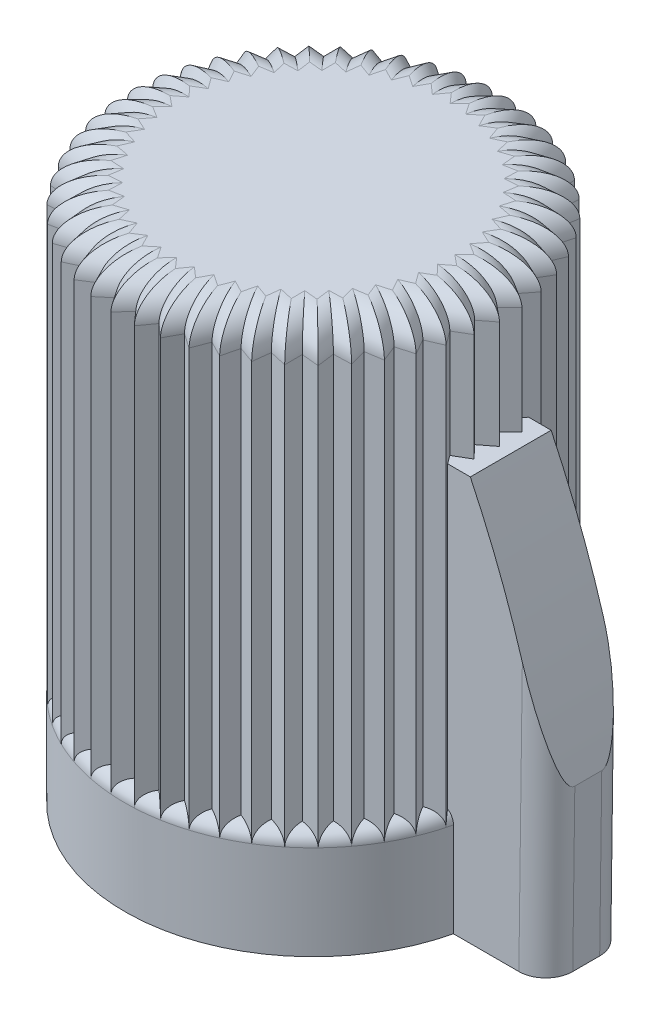
from build123d import *

# Parameters (mm, degrees)
SKETCH1_R           = 7
BOSS_EXTRUDE1_DEPTH = 20
SKETCH2_R           = 3.125
CUT_EXTRUDE1_DEPTH  = 17
SKETCH3_R           = 6
CUT_EXTRUDE2_DEPTH  = 4
SKETCH4_OUTSIDE_W   = 21.628
SKETCH4_OUTSIDE_H   = 21.628
CUT_EXTRUDE4_DEPTH  = 16
FILLET1_R           = 0.5
FILLET2_R           = 1
SKETCH5_W           = 5
SKETCH5_H           = 3
BOSS_EXTRUDE2_DEPTH = 15
CUT_EXTRUDE5_DEPTH  = 25.244872775
CUT_EXTRUDE6_DEPTH  = 25.244872775
FILLET10_R          = 1


with BuildPart() as part:
    # Sketch1 → Boss-Extrude1 (new body)
    with BuildSketch(Plane(origin=(0, 0, 0), x_dir=(1, 0, 0), z_dir=(0, 1, 0))):
        with Locations(Location((0, 0, 0), (0, 0, 270))):
            Circle(SKETCH1_R)
    extrude(amount=BOSS_EXTRUDE1_DEPTH)

    # Sketch2 → Cut-Extrude1 (cut)
    with BuildSketch(Plane.XZ):
        with Locations(Location((0, 0, 0), (0, 0, 270))):
            Circle(SKETCH2_R)
    extrude(amount=-CUT_EXTRUDE1_DEPTH, mode=Mode.SUBTRACT)

    # Sketch3 → Cut-Extrude2 (cut)
    with BuildSketch(Plane.XZ):
        with Locations(Location((0, 0, 0), (0, 0, 270))):
            Circle(SKETCH3_R)
    extrude(amount=-CUT_EXTRUDE2_DEPTH, mode=Mode.SUBTRACT)

    # Sketch4 outside → Cut-Extrude4 (cut)
    with BuildSketch(Plane(origin=(0, 20, 0), x_dir=(1, 0, 0), z_dir=(0, 1, 0))):
        Rectangle(SKETCH4_OUTSIDE_W, SKETCH4_OUTSIDE_H)
        Polygon((6.368056357, -1.303018892), (6.756263467, -1.831093653), (6.154530759, -2.090873294), (6.473491423, -2.66343928), (5.843944535, -2.845753375), (6.088628552, -3.453780878), (5.441195815, -3.555754225), (5.607744372, -4.189654289), (4.952636186, -4.209678706), (5.038422713, -4.859454348), (4.385970526, -4.79721404), (4.389642118, -5.45261791), (3.75013549, -5.309094443), (3.671634245, -5.95979043), (3.055158578, -5.737247255), (2.895722506, -6.372973495), (2.31199999, -6.07492025), (2.074143494, -6.685650961), (1.532379781, -6.316788124), (1.219854, -6.892891717), (0.728593027, -6.459036476), (0.346326679, -6.991427453), (-0.086684074, -6.499421964), (-0.53266242, -6.979704202), (-0.900594115, -6.437307686), (-1.403251115, -6.857906846), (-1.700301249, -6.273673219), (-2.251709701, -6.627956202), (-2.473193617, -6.011099178), (-3.06465748, -6.29347873), (-3.207082244, -5.653726513), (-3.82927378, -5.859749339), (-3.890393268, -5.207191203), (-4.533500145, -5.3336082), (-4.512350466, -4.678535377), (-5.166230505, -4.723352874), (-5.063145202, -4.076096253), (-5.717486323, -4.038607451), (-5.534091114, -3.409374656), (-6.178573967, -3.290170776), (-5.917761102, -2.688885185), (-6.542221808, -2.489846143), (-6.208104463, -1.925990387), (-6.802694903, -1.650255148), (-6.400542308, -1.132721571), (-6.955885436, -0.784638645), (-6.492039778, -0.321589059), (-6.9993775, 0.093352079), (-6.481153902, 0.494615104), (-6.9324852, 0.969870585), (-6.368056357, 1.303018892), (-6.756263467, 1.831093653), (-6.154530759, 2.090873294), (-6.473491423, 2.66343928), (-5.843944535, 2.845753375), (-6.088628552, 3.453780878), (-5.441195815, 3.555754225), (-5.607744372, 4.189654289), (-4.952636186, 4.209678706), (-5.038422713, 4.859454348), (-4.385970526, 4.79721404), (-4.389642118, 5.45261791), (-3.75013549, 5.309094443), (-3.671634245, 5.95979043), (-3.055158578, 5.737247255), (-2.895722506, 6.372973495), (-2.31199999, 6.07492025), (-2.074143494, 6.685650961), (-1.532379781, 6.316788124), (-1.219854, 6.892891717), (-0.728593027, 6.459036476), (-0.346326679, 6.991427453), (0.086684074, 6.499421964), (0.53266242, 6.979704202), (0.900594115, 6.437307686), (1.403251115, 6.857906846), (1.700301249, 6.273673219), (2.251709701, 6.627956202), (2.473193617, 6.011099178), (3.06465748, 6.29347873), (3.207082244, 5.653726513), (3.82927378, 5.859749339), (3.890393268, 5.207191203), (4.533500145, 5.3336082), (4.512350466, 4.678535377), (5.166230505, 4.723352874), (5.063145202, 4.076096253), (5.717486323, 4.038607451), (5.534091114, 3.409374656), (6.178573967, 3.290170776), (5.917761102, 2.688885185), (6.542221808, 2.489846143), (6.208104463, 1.925990387), (6.802694903, 1.650255148), (6.400542308, 1.132721571), (6.955885436, 0.784638645), (6.492039778, 0.321589059), (6.9993775, -0.093352079), (6.481153902, -0.494615104), (6.9324852, -0.969870585), align=None, mode=Mode.SUBTRACT)
    extrude(amount=-CUT_EXTRUDE4_DEPTH, mode=Mode.SUBTRACT)

    # Fillet1
    # the kernel refuses this fillet: 0.5 mm, written as the material it takes off along each edge
    with BuildSketch(Plane(origin=(0, 4, 0), x_dir=(0.9999110714464502, 0, 0.013336011353174413), z_dir=(0.013336011353174413, 0, -0.9999110714464502))) as fillet1_piece_1_section:
        with BuildLine():
            CenterArc((7 - FILLET1_R, FILLET1_R), FILLET1_R, 270, 90)
            Line((7 - FILLET1_R, 0), (7, 0))
            Line((7, 0), (7, FILLET1_R))
        make_face()
    fillet1_piece_1 = revolve(axis=Axis((0, 4, 0), (0, -1, 0)), revolution_arc=7.2, mode=Mode.PRIVATE)
    fillet1_piece_1 = split(fillet1_piece_1, bisect_by=Plane(origin=(6.692100794, 3.869530102, 0.716743876), z_dir=(0.7251223952651457, 0, -0.6886200054347376)), keep=Keep.TOP, mode=Mode.PRIVATE)
    fillet1_piece_1 = split(fillet1_piece_1, bisect_by=Plane(origin=(6.723365439, 3.869530102, 0.307069546), z_dir=(0.6122281957924257, 0, 0.7906811217404595)), keep=Keep.TOP, mode=Mode.PRIVATE)
    add(fillet1_piece_1, mode=Mode.SUBTRACT)
    with BuildSketch(Plane(origin=(0, 4, 0), x_dir=(0.9903550285633907, 0, 0.13855294078151292), z_dir=(0.13855294078151292, 0, -0.9903550285633907))) as fillet1_piece_2_section:
        with BuildLine():
            CenterArc((7 - FILLET1_R, FILLET1_R), FILLET1_R, 270, 90)
            Line((7 - FILLET1_R, 0), (7, 0))
            Line((7, 0), (7, FILLET1_R))
        make_face()
    fillet1_piece_2 = revolve(axis=Axis((0, 4, 0), (0, -1, 0)), revolution_arc=7.2, mode=Mode.PRIVATE)
    fillet1_piece_2 = split(fillet1_piece_2, bisect_by=Plane(origin=(6.631863682, 3.86953012, 1.147309338), z_dir=(0.508301971898917, 0, 0.8611789043884395)), keep=Keep.TOP, mode=Mode.PRIVATE)
    fillet1_piece_2 = split(fillet1_piece_2, bisect_by=Plane(origin=(6.549499752, 3.86953012, 1.549834767), z_dir=(0.8057115605731215, 0, -0.5923080964825866)), keep=Keep.TOP, mode=Mode.PRIVATE)
    add(fillet1_piece_2, mode=Mode.SUBTRACT)
    with BuildSketch(Plane(origin=(0, 4, 0), x_dir=(0.9651804952704691, 0, 0.2615848075662121), z_dir=(0.2615848075662121, 0, -0.9651804952704691))) as fillet1_piece_3_section:
        with BuildLine():
            CenterArc((7 - FILLET1_R, FILLET1_R), FILLET1_R, 270, 90)
            Line((7 - FILLET1_R, 0), (7, 0))
            Line((7, 0), (7, FILLET1_R))
        make_face()
    fillet1_piece_3 = revolve(axis=Axis((0, 4, 0), (0, -1, 0)), revolution_arc=7.2, mode=Mode.PRIVATE)
    fillet1_piece_3 = split(fillet1_piece_3, bisect_by=Plane(origin=(6.303609189, 3.869530083, 2.358483842), z_dir=(0.8735941732621048, 0, -0.4866551350211972)), keep=Keep.TOP, mode=Mode.PRIVATE)
    fillet1_piece_3 = split(fillet1_piece_3, bisect_by=Plane(origin=(6.435773453, 3.869530083, 1.969455387), z_dir=(0.3963595222636914, 0, 0.9180953812708669)), keep=Keep.TOP, mode=Mode.PRIVATE)
    add(fillet1_piece_3, mode=Mode.SUBTRACT)
    with BuildSketch(Plane(origin=(0, 4, 0), x_dir=(0.9247844889962518, 0, 0.3804913256724016), z_dir=(0.3804913256724016, 0, -0.9247844889962518))) as fillet1_piece_4_section:
        with BuildLine():
            CenterArc((7 - FILLET1_R, FILLET1_R), FILLET1_R, 270, 90)
            Line((7 - FILLET1_R, 0), (7, 0))
            Line((7, 0), (7, FILLET1_R))
        make_face()
    fillet1_piece_4 = revolve(axis=Axis((0, 4, 0), (0, -1, 0)), revolution_arc=7.2, mode=Mode.PRIVATE)
    fillet1_piece_4 = split(fillet1_piece_4, bisect_by=Plane(origin=(5.958306941, 3.869530109, 3.129938213), z_dir=(0.9276996839788816, 0, -0.3733273313668364)), keep=Keep.TOP, mode=Mode.PRIVATE)
    fillet1_piece_4 = split(fillet1_piece_4, bisect_by=Plane(origin=(6.138187255, 3.869530109, 2.760541937), z_dir=(0.27816624618866026, 0, 0.9605329455470591)), keep=Keep.TOP, mode=Mode.PRIVATE)
    add(fillet1_piece_4, mode=Mode.SUBTRACT)
    with BuildSketch(Plane(origin=(0, 4, 0), x_dir=(0.8698040788910874, 0, 0.49339726827823754), z_dir=(0.49339726827823754, 0, -0.8698040788910874))) as fillet1_piece_5_section:
        with BuildLine():
            CenterArc((7 - FILLET1_R, FILLET1_R), FILLET1_R, 270, 90)
            Line((7 - FILLET1_R, 0), (7, 0))
            Line((7, 0), (7, FILLET1_R))
        make_face()
    fillet1_piece_5 = revolve(axis=Axis((0, 4, 0), (0, -1, 0)), revolution_arc=7.2, mode=Mode.PRIVATE)
    fillet1_piece_5 = split(fillet1_piece_5, bisect_by=Plane(origin=(5.519038633, 3.86953012, 3.85203159), z_dir=(0.9671748164983809, 0, -0.2541119326818861)), keep=Keep.TOP, mode=Mode.PRIVATE)
    fillet1_piece_5 = split(fillet1_piece_5, bisect_by=Plane(origin=(5.743798172, 3.86953012, 3.508093096), z_dir=(0.1555861222427738, 0, 0.9878223314774053)), keep=Keep.TOP, mode=Mode.PRIVATE)
    add(fillet1_piece_5, mode=Mode.SUBTRACT)
    with BuildSketch(Plane(origin=(0, 4, 0), x_dir=(0.8011063388660395, 0, 0.5985220412220841), z_dir=(0.5985220412220841, 0, -0.8011063388660395))) as fillet1_piece_6_section:
        with BuildLine():
            CenterArc((7 - FILLET1_R, FILLET1_R), FILLET1_R, 270, 90)
            Line((7 - FILLET1_R, 0), (7, 0))
            Line((7, 0), (7, FILLET1_R))
        make_face()
    fillet1_piece_6 = revolve(axis=Axis((0, 4, 0), (0, -1, 0)), revolution_arc=7.2, mode=Mode.PRIVATE)
    fillet1_piece_6 = split(fillet1_piece_6, bisect_by=Plane(origin=(4.992731791, 3.869530084, 4.513376131), z_dir=(0.9913970243994719, 0, -0.13088903701942792)), keep=Keep.TOP, mode=Mode.PRIVATE)
    fillet1_piece_6 = split(fillet1_piece_6, bisect_by=Plane(origin=(5.258825942, 3.869530084, 4.200319532), z_dir=(0.030552312206472972, 0, 0.999533169143895)), keep=Keep.TOP, mode=Mode.PRIVATE)
    add(fillet1_piece_6, mode=Mode.SUBTRACT)
    with BuildSketch(Plane(origin=(0, 4, 0), x_dir=(0.7197746733193445, 0, 0.694207764036121), z_dir=(0.694207764036121, 0, -0.7197746733193445))) as fillet1_piece_7_section:
        with BuildLine():
            CenterArc((7 - FILLET1_R, FILLET1_R), FILLET1_R, 270, 90)
            Line((7 - FILLET1_R, 0), (7, 0))
            Line((7, 0), (7, FILLET1_R))
        make_face()
    fillet1_piece_7 = revolve(axis=Axis((0, 4, 0), (0, -1, 0)), revolution_arc=7.2, mode=Mode.PRIVATE)
    fillet1_piece_7 = split(fillet1_piece_7, bisect_by=Plane(origin=(4.387686585, 3.869530084, 5.103542032), z_dir=(0.9999843089939069, 0, -0.005601943053854549)), keep=Keep.TOP, mode=Mode.PRIVATE)
    fillet1_piece_7 = split(fillet1_piece_7, bisect_by=Plane(origin=(4.6909189, 3.869530084, 4.826304418), z_dir=(-0.09496332604438978, 0, 0.9954807716408123)), keep=Keep.TOP, mode=Mode.PRIVATE)
    add(fillet1_piece_7, mode=Mode.SUBTRACT)
    with BuildSketch(Plane(origin=(0, 4, 0), x_dir=(0.6270917312018547, 0, 0.7789454157116921), z_dir=(0.7789454157116921, 0, -0.6270917312018547))) as fillet1_piece_8_section:
        with BuildLine():
            CenterArc((7 - FILLET1_R, FILLET1_R), FILLET1_R, 270, 90)
            Line((7 - FILLET1_R, 0), (7, 0))
            Line((7, 0), (7, FILLET1_R))
        make_face()
    fillet1_piece_8 = revolve(axis=Axis((0, 4, 0), (0, -1, 0)), revolution_arc=7.2, mode=Mode.PRIVATE)
    fillet1_piece_8 = split(fillet1_piece_8, bisect_by=Plane(origin=(3.71344494, 3.869530103, 5.613222025), z_dir=(0.992801243673837, 0, 0.11977349690011761)), keep=Keep.TOP, mode=Mode.PRIVATE)
    fillet1_piece_8 = split(fillet1_piece_8, bisect_by=Plane(origin=(4.049033272, 3.869530103, 5.376175602), z_dir=(-0.2189813359151886, 0, 0.9757290476975662)), keep=Keep.TOP, mode=Mode.PRIVATE)
    add(fillet1_piece_8, mode=Mode.SUBTRACT)
    with BuildSketch(Plane(origin=(0, 4, 0), x_dir=(0.5245191778768692, 0, 0.8513986328620532), z_dir=(0.8513986328620532, 0, -0.5245191778768692))) as fillet1_piece_9_section:
        with BuildLine():
            CenterArc((7 - FILLET1_R, FILLET1_R), FILLET1_R, 270, 90)
            Line((7 - FILLET1_R, 0), (7, 0))
            Line((7, 0), (7, FILLET1_R))
        make_face()
    fillet1_piece_9 = revolve(axis=Axis((0, 4, 0), (0, -1, 0)), revolution_arc=7.2, mode=Mode.PRIVATE)
    fillet1_piece_9 = split(fillet1_piece_9, bisect_by=Plane(origin=(2.980640051, 3.86953012, 6.034378153), z_dir=(0.9699611096703153, 0, 0.24326003725875428)), keep=Keep.TOP, mode=Mode.PRIVATE)
    fillet1_piece_9 = split(fillet1_piece_9, bisect_by=Plane(origin=(3.343291969, 3.86953012, 5.841261287), z_dir=(-0.3395458793054989, 0, 0.9405894937998487)), keep=Keep.TOP, mode=Mode.PRIVATE)
    add(fillet1_piece_9, mode=Mode.SUBTRACT)
    with BuildSketch(Plane(origin=(0, 4, 0), x_dir=(0.41367464378419627, 0, 0.9104247849712893), z_dir=(0.9104247849712893, 0, -0.41367464378419627))) as fillet1_piece_10_section:
        with BuildLine():
            CenterArc((7 - FILLET1_R, FILLET1_R), FILLET1_R, 270, 90)
            Line((7 - FILLET1_R, 0), (7, 0))
            Line((7, 0), (7, FILLET1_R))
        make_face()
    fillet1_piece_10 = revolve(axis=Axis((0, 4, 0), (0, -1, 0)), revolution_arc=7.2, mode=Mode.PRIVATE)
    fillet1_piece_10 = split(fillet1_piece_10, bisect_by=Plane(origin=(2.200828687, 3.86953012, 6.360368535), z_dir=(0.9318241095406106, 0, 0.36291022151332175)), keep=Keep.TOP, mode=Mode.PRIVATE)
    fillet1_piece_10 = split(fillet1_piece_10, bisect_by=Plane(origin=(2.584824948, 3.86953012, 6.21422679), z_dir=(-0.45475558134428334, 0, 0.8906162817039799)), keep=Keep.TOP, mode=Mode.PRIVATE)
    add(fillet1_piece_10, mode=Mode.SUBTRACT)
    with BuildSketch(Plane(origin=(0, 4, 0), x_dir=(0.29630621344179275, 0, 0.9550929943601235), z_dir=(0.9550929943601235, 0, -0.29630621344179275))) as fillet1_piece_11_section:
        with BuildLine():
            CenterArc((7 - FILLET1_R, FILLET1_R), FILLET1_R, 270, 90)
            Line((7 - FILLET1_R, 0), (7, 0))
            Line((7, 0), (7, FILLET1_R))
        make_face()
    fillet1_piece_11 = revolve(axis=Axis((0, 4, 0), (0, -1, 0)), revolution_arc=7.2, mode=Mode.PRIVATE)
    fillet1_piece_11 = split(fillet1_piece_11, bisect_by=Plane(origin=(1.386308941, 3.86953012, 6.586052105), z_dir=(0.8789916865587111, 0, 0.4768370947825607)), keep=Keep.TOP, mode=Mode.PRIVATE)
    fillet1_piece_11 = split(fillet1_piece_11, bisect_by=Plane(origin=(1.785593694, 3.86953012, 6.489190225), z_dir=(-0.5627935162074544, 0, 0.8265975188172595)), keep=Keep.TOP, mode=Mode.PRIVATE)
    add(fillet1_piece_11, mode=Mode.SUBTRACT)
    with BuildSketch(Plane(origin=(0, 4, 0), x_dir=(0.17426485710865985, 0, 0.984698816682999), z_dir=(0.984698816682999, 0, -0.17426485710865985))) as fillet1_piece_12_section:
        with BuildLine():
            CenterArc((7 - FILLET1_R, FILLET1_R), FILLET1_R, 270, 90)
            Line((7 - FILLET1_R, 0), (7, 0))
            Line((7, 0), (7, FILLET1_R))
        make_face()
    fillet1_piece_12 = revolve(axis=Axis((0, 4, 0), (0, -1, 0)), revolution_arc=7.2, mode=Mode.PRIVATE)
    fillet1_piece_12 = split(fillet1_piece_12, bisect_by=Plane(origin=(0.549926273, 3.869530099, 6.7078697), z_dir=(0.8122970395955981, 0, 0.583243962218408)), keep=Keep.TOP, mode=Mode.PRIVATE)
    fillet1_piece_12 = split(fillet1_piece_12, bisect_by=Plane(origin=(0.958202554, 3.869530099, 6.661815248), z_dir=(-0.6619558611234801, 0, 0.7495428192733701)), keep=Keep.TOP, mode=Mode.PRIVATE)
    add(fillet1_piece_12, mode=Mode.SUBTRACT)
    with BuildSketch(Plane(origin=(0, 4, 0), x_dir=(0, 0, 1), z_dir=(1, 0, 0))) as fillet1_piece_13_section:
        with BuildLine():
            CenterArc((7 - FILLET1_R, FILLET1_R), FILLET1_R, 270, 90)
            Line((7 - FILLET1_R, 0), (7, 0))
            Line((7, 0), (7, FILLET1_R))
        make_face()
    fillet1_piece_13 = revolve(axis=Axis((0, 4, 0), (0, -1, 0)), revolution_arc=4.364119817, mode=Mode.PRIVATE)
    fillet1_piece_13 = split(fillet1_piece_13, bisect_by=Plane(origin=(-0.354413495, 3.872749613, 6.787744674), z_dir=(0.732791983075327, 0, 0.680452723957021)), keep=Keep.TOP, mode=Mode.PRIVATE)
    fillet1_piece_13 = split(fillet1_piece_13, bisect_by=Plane(origin=(0.053658359, 3.872749613, 6.658885087), z_dir=(-0.7506787666763268, 0, 0.6606673817143609)), keep=Keep.TOP, mode=Mode.PRIVATE)
    add(fillet1_piece_13, mode=Mode.SUBTRACT)
    with BuildSketch(Plane(origin=(0, 4, 0), x_dir=(-0.07609463144032609, 0, 0.9971006002735938), z_dir=(0.9971006002735938, 0, 0.07609463144032609))) as fillet1_piece_14_section:
        with BuildLine():
            CenterArc((7 - FILLET1_R, FILLET1_R), FILLET1_R, 270, 90)
            Line((7 - FILLET1_R, 0), (7, 0))
            Line((7, 0), (7, FILLET1_R))
        make_face()
    fillet1_piece_14 = revolve(axis=Axis((0, 4, 0), (0, -1, 0)), revolution_arc=7.2, mode=Mode.PRIVATE)
    fillet1_piece_14 = split(fillet1_piece_14, bisect_by=Plane(origin=(-1.13553003, 3.86953012, 6.633890741), z_dir=(0.6417303592332552, 0, 0.7669303397560676)), keep=Keep.TOP, mode=Mode.PRIVATE)
    fillet1_piece_14 = split(fillet1_piece_14, bisect_by=Plane(origin=(-0.728627219, 3.86953012, 6.690817363), z_dir=(-0.8275630196449273, 0, 0.5613728248821542)), keep=Keep.TOP, mode=Mode.PRIVATE)
    add(fillet1_piece_14, mode=Mode.SUBTRACT)
    with BuildSketch(Plane(origin=(0, 4, 0), x_dir=(-0.2004644449642526, 0, 0.9797009780056228), z_dir=(0.9797009780056228, 0, 0.2004644449642526))) as fillet1_piece_15_section:
        with BuildLine():
            CenterArc((7 - FILLET1_R, FILLET1_R), FILLET1_R, 270, 90)
            Line((7 - FILLET1_R, 0), (7, 0))
            Line((7, 0), (7, FILLET1_R))
        make_face()
    fillet1_piece_15 = revolve(axis=Axis((0, 4, 0), (0, -1, 0)), revolution_arc=7.2, mode=Mode.PRIVATE)
    fillet1_piece_15 = split(fillet1_piece_15, bisect_by=Plane(origin=(-1.958023014, 3.86953012, 6.43926088), z_dir=(0.5405482642749323, 0, 0.8413130059551903)), keep=Keep.TOP, mode=Mode.PRIVATE)
    fillet1_piece_15 = split(fillet1_piece_15, bisect_by=Plane(origin=(-1.561463551, 3.86953012, 6.546737065), z_dir=(-0.8913961094315425, 0, 0.453225083253685)), keep=Keep.TOP, mode=Mode.PRIVATE)
    add(fillet1_piece_15, mode=Mode.SUBTRACT)
    with BuildSketch(Plane(origin=(0, 4, 0), x_dir=(-0.32167281443943807, 0, 0.9468508860695071), z_dir=(0.9468508860695071, 0, 0.32167281443943807))) as fillet1_piece_16_section:
        with BuildLine():
            CenterArc((7 - FILLET1_R, FILLET1_R), FILLET1_R, 270, 90)
            Line((7 - FILLET1_R, 0), (7, 0))
            Line((7, 0), (7, FILLET1_R))
        make_face()
    fillet1_piece_16 = revolve(axis=Axis((0, 4, 0), (0, -1, 0)), revolution_arc=7.2, mode=Mode.PRIVATE)
    fillet1_piece_16 = split(fillet1_piece_16, bisect_by=Plane(origin=(-2.749636806, 3.86953012, 6.143080029), z_dir=(0.4308414002811142, 0, 0.9024276634743689)), keep=Keep.TOP, mode=Mode.PRIVATE)
    fillet1_piece_16 = split(fillet1_piece_16, bisect_by=Plane(origin=(-2.36967467, 3.86953012, 6.299410812), z_dir=(-0.9411713500781984, 0, 0.3379297113187614)), keep=Keep.TOP, mode=Mode.PRIVATE)
    add(fillet1_piece_16, mode=Mode.SUBTRACT)
    with BuildSketch(Plane(origin=(0, 4, 0), x_dir=(-0.4378082114728888, 0, 0.8990683900387725), z_dir=(0.8990683900387725, 0, 0.4378082114728888))) as fillet1_piece_17_section:
        with BuildLine():
            CenterArc((7 - FILLET1_R, FILLET1_R), FILLET1_R, 270, 90)
            Line((7 - FILLET1_R, 0), (7, 0))
            Line((7, 0), (7, FILLET1_R))
        make_face()
    fillet1_piece_17 = revolve(axis=Axis((0, 4, 0), (0, -1, 0)), revolution_arc=7.2, mode=Mode.PRIVATE)
    fillet1_piece_17 = split(fillet1_piece_17, bisect_by=Plane(origin=(-3.497887182, 3.86953012, 5.750019136), z_dir=(0.3143399100326887, 0, 0.9493104976563996)), keep=Keep.TOP, mode=Mode.PRIVATE)
    fillet1_piece_17 = split(fillet1_piece_17, bisect_by=Plane(origin=(-3.140514604, 3.86953012, 5.952739087), z_dir=(-0.9761037563056076, 0, 0.2173049859669195)), keep=Keep.TOP, mode=Mode.PRIVATE)
    add(fillet1_piece_17, mode=Mode.SUBTRACT)
    with BuildSketch(Plane(origin=(0, 4, 0), x_dir=(-0.547039111477463, 0, 0.8371070484197034), z_dir=(0.8371070484197034, 0, 0.547039111477463))) as fillet1_piece_18_section:
        with BuildLine():
            CenterArc((7 - FILLET1_R, FILLET1_R), FILLET1_R, 270, 90)
            Line((7 - FILLET1_R, 0), (7, 0))
            Line((7, 0), (7, FILLET1_R))
        make_face()
    fillet1_piece_18 = revolve(axis=Axis((0, 4, 0), (0, -1, 0)), revolution_arc=7.2, mode=Mode.PRIVATE)
    fillet1_piece_18 = split(fillet1_piece_18, bisect_by=Plane(origin=(-4.190973788, 3.86953012, 5.266277007), z_dir=(0.1928810916254839, 0, 0.981222138199787)), keep=Keep.TOP, mode=Mode.PRIVATE)
    fillet1_piece_18 = split(fillet1_piece_18, bisect_by=Plane(origin=(-3.861826747, 3.86953012, 5.512189111), z_dir=(-0.9956424231999574, 0, 0.09325323117467292)), keep=Keep.TOP, mode=Mode.PRIVATE)
    add(fillet1_piece_18, mode=Mode.SUBTRACT)
    with BuildSketch(Plane(origin=(0, 4, 0), x_dir=(-0.6476428779087126, 0, 0.7619440285835439), z_dir=(0.7619440285835439, 0, 0.6476428779087126))) as fillet1_piece_19_section:
        with BuildLine():
            CenterArc((7 - FILLET1_R, FILLET1_R), FILLET1_R, 270, 90)
            Line((7 - FILLET1_R, 0), (7, 0))
            Line((7, 0), (7, FILLET1_R))
        make_face()
    fillet1_piece_19 = revolve(axis=Axis((0, 4, 0), (0, -1, 0)), revolution_arc=7.2, mode=Mode.PRIVATE)
    fillet1_piece_19 = split(fillet1_piece_19, bisect_by=Plane(origin=(-4.817966234, 3.86953012, 4.699482543), z_dir=(0.06838042318176764, 0, 0.9976593194700696)), keep=Keep.TOP, mode=Mode.PRIVATE)
    fillet1_piece_19 = split(fillet1_piece_19, bisect_by=Plane(origin=(-4.522235575, 3.86953012, 4.98470862), z_dir=(-0.9994792143124901, 0, -0.03226918277997783)), keep=Keep.TOP, mode=Mode.PRIVATE)
    add(fillet1_piece_19, mode=Mode.SUBTRACT)
    with BuildSketch(Plane(origin=(0, 4, 0), x_dir=(-0.7380329292722395, 0, 0.6747646962533217), z_dir=(0.6747646962533217, 0, 0.7380329292722395))) as fillet1_piece_20_section:
        with BuildLine():
            CenterArc((7 - FILLET1_R, FILLET1_R), FILLET1_R, 270, 90)
            Line((7 - FILLET1_R, 0), (7, 0))
            Line((7, 0), (7, FILLET1_R))
        make_face()
    fillet1_piece_20 = revolve(axis=Axis((0, 4, 0), (0, -1, 0)), revolution_arc=7.2, mode=Mode.PRIVATE)
    fillet1_piece_20 = split(fillet1_piece_20, bisect_by=Plane(origin=(-5.368976475, 3.86953012, 4.058574432), z_dir=(-0.05719864538400738, 0, 0.9983628172995199)), keep=Keep.TOP, mode=Mode.PRIVATE)
    fillet1_piece_20 = split(fillet1_piece_20, bisect_by=Plane(origin=(-5.111326046, 3.86953012, 4.378616296), z_dir=(-0.9875536211553725, 0, -0.15728269244551726)), keep=Keep.TOP, mode=Mode.PRIVATE)
    add(fillet1_piece_20, mode=Mode.SUBTRACT)
    with BuildSketch(Plane(origin=(0, 4, 0), x_dir=(-0.8167837604616414, 0, 0.5769439215782936), z_dir=(0.5769439215782936, 0, 0.8167837604616414))) as fillet1_piece_21_section:
        with BuildLine():
            CenterArc((7 - FILLET1_R, FILLET1_R), FILLET1_R, 270, 90)
            Line((7 - FILLET1_R, 0), (7, 0))
            Line((7, 0), (7, FILLET1_R))
        make_face()
    fillet1_piece_21 = revolve(axis=Axis((0, 4, 0), (0, -1, 0)), revolution_arc=7.2, mode=Mode.PRIVATE)
    fillet1_piece_21 = split(fillet1_piece_21, bisect_by=Plane(origin=(-5.835314749, 3.86953012, 3.353660178), z_dir=(-0.18187565714326803, 0, 0.9833215371071177)), keep=Keep.TOP, mode=Mode.PRIVATE)
    fillet1_piece_21 = split(fillet1_piece_21, bisect_by=Plane(origin=(-5.619807852, 3.86953012, 3.703470577), z_dir=(-0.9600537174566968, 0, -0.27981576009506187)), keep=Keep.TOP, mode=Mode.PRIVATE)
    add(fillet1_piece_21, mode=Mode.SUBTRACT)
    with BuildSketch(Plane(origin=(0, 4, 0), x_dir=(-0.8826534238255954, 0, 0.47002439661038226), z_dir=(0.47002439661038226, 0, 0.8826534238255954))) as fillet1_piece_22_section:
        with BuildLine():
            CenterArc((7 - FILLET1_R, FILLET1_R), FILLET1_R, 270, 90)
            Line((7 - FILLET1_R, 0), (7, 0))
            Line((7, 0), (7, FILLET1_R))
        make_face()
    fillet1_piece_22 = revolve(axis=Axis((0, 4, 0), (0, -1, 0)), revolution_arc=7.2, mode=Mode.PRIVATE)
    fillet1_piece_22 = split(fillet1_piece_22, bisect_by=Plane(origin=(-6.209626625, 3.869530103, 2.595856699), z_dir=(-0.30368438114212065, 0, 0.9527726888667241)), keep=Keep.TOP, mode=Mode.PRIVATE)
    fillet1_piece_22 = split(fillet1_piece_22, bisect_by=Plane(origin=(-6.039661929, 3.869530103, 2.969918909), z_dir=(-0.9174131931254367, 0, -0.39793596605407533)), keep=Keep.TOP, mode=Mode.PRIVATE)
    add(fillet1_piece_22, mode=Mode.SUBTRACT)
    with BuildSketch(Plane(origin=(0, 4, 0), x_dir=(-0.9346031154242217, 0, 0.3556923061289616), z_dir=(0.3556923061289616, 0, 0.9346031154242217))) as fillet1_piece_23_section:
        with BuildLine():
            CenterArc((7 - FILLET1_R, FILLET1_R), FILLET1_R, 270, 90)
            Line((7 - FILLET1_R, 0), (7, 0))
            Line((7, 0), (7, FILLET1_R))
        make_face()
    fillet1_piece_23 = revolve(axis=Axis((0, 4, 0), (0, -1, 0)), revolution_arc=7.2, mode=Mode.PRIVATE)
    fillet1_piece_23 = split(fillet1_piece_23, bisect_by=Plane(origin=(-6.486008977, 3.869530111, 1.79711501), z_dir=(-0.42070382103811527, 0, 0.907198046164083)), keep=Keep.TOP, mode=Mode.PRIVATE)
    fillet1_piece_23 = split(fillet1_piece_23, bisect_by=Plane(origin=(-6.364266933, 3.869530111, 2.189529855), z_dir=(-0.8603045147025131, 0, -0.5097804841129894)), keep=Keep.TOP, mode=Mode.PRIVATE)
    add(fillet1_piece_23, mode=Mode.SUBTRACT)
    with BuildSketch(Plane(origin=(0, 4, 0), x_dir=(-0.9718135575877694, 0, 0.23575073549960174), z_dir=(0.23575073549960174, 0, 0.9718135575877694))) as fillet1_piece_24_section:
        with BuildLine():
            CenterArc((7 - FILLET1_R, FILLET1_R), FILLET1_R, 270, 90)
            Line((7 - FILLET1_R, 0), (7, 0))
            Line((7, 0), (7, FILLET1_R))
        make_face()
    fillet1_piece_24 = revolve(axis=Axis((0, 4, 0), (0, -1, 0)), revolution_arc=7.2, mode=Mode.PRIVATE)
    fillet1_piece_24 = split(fillet1_piece_24, bisect_by=Plane(origin=(-6.660103094, 3.86953012, 0.970031743), z_dir=(-0.5310885103600534, 0, 0.8473163483395912)), keep=Keep.TOP, mode=Mode.PRIVATE)
    fillet1_piece_24 = split(fillet1_piece_24, bisect_by=Plane(origin=(-6.588503646, 3.86953012, 1.374610607), z_dir=(-0.7896283201617239, 0, -0.6135854594093427)), keep=Keep.TOP, mode=Mode.PRIVATE)
    add(fillet1_piece_24, mode=Mode.SUBTRACT)
    with BuildSketch(Plane(origin=(0, 4, 0), x_dir=(-0.993697919414878, 0, 0.11209123494075034), z_dir=(0.11209123494075034, 0, 0.993697919414878))) as fillet1_piece_25_section:
        with BuildLine():
            CenterArc((7 - FILLET1_R, FILLET1_R), FILLET1_R, 270, 90)
            Line((7 - FILLET1_R, 0), (7, 0))
            Line((7, 0), (7, FILLET1_R))
        make_face()
    fillet1_piece_25 = revolve(axis=Axis((0, 4, 0), (0, -1, 0)), revolution_arc=7.2, mode=Mode.PRIVATE)
    fillet1_piece_25 = split(fillet1_piece_25, bisect_by=Plane(origin=(-6.729163407, 3.86953012, 0.127650497), z_dir=(-0.6330976166167106, 0, 0.774071965539536)), keep=Keep.TOP, mode=Mode.PRIVATE)
    fillet1_piece_25 = split(fillet1_piece_25, bisect_by=Plane(origin=(-6.708835719, 3.86953012, 0.538012926), z_dir=(-0.706499215310887, 0, -0.7077138254726277)), keep=Keep.TOP, mode=Mode.PRIVATE)
    add(fillet1_piece_25, mode=Mode.SUBTRACT)
    with BuildSketch(Plane(origin=(0, 4, 0), x_dir=(-0.9999110714464502, 0, -0.013336011353174314), z_dir=(-0.013336011353174314, 0, 0.9999110714464502))) as fillet1_piece_26_section:
        with BuildLine():
            CenterArc((7 - FILLET1_R, FILLET1_R), FILLET1_R, 270, 90)
            Line((7 - FILLET1_R, 0), (7, 0))
            Line((7, 0), (7, FILLET1_R))
        make_face()
    fillet1_piece_26 = revolve(axis=Axis((0, 4, 0), (0, -1, 0)), revolution_arc=7.2, mode=Mode.PRIVATE)
    fillet1_piece_26 = split(fillet1_piece_26, bisect_by=Plane(origin=(-6.692100793, 3.86953012, -0.716743875), z_dir=(-0.7251223952651459, 0, 0.6886200054347373)), keep=Keep.TOP, mode=Mode.PRIVATE)
    fillet1_piece_26 = split(fillet1_piece_26, bisect_by=Plane(origin=(-6.723365445, 3.86953012, -0.307069541), z_dir=(-0.6122281957924258, 0, -0.7906811217404595)), keep=Keep.TOP, mode=Mode.PRIVATE)
    add(fillet1_piece_26, mode=Mode.SUBTRACT)
    with BuildSketch(Plane(origin=(0, 4, 0), x_dir=(-0.9903550285633907, 0, -0.13855294078151303), z_dir=(-0.13855294078151303, 0, 0.9903550285633907))) as fillet1_piece_27_section:
        with BuildLine():
            CenterArc((7 - FILLET1_R, FILLET1_R), FILLET1_R, 270, 90)
            Line((7 - FILLET1_R, 0), (7, 0))
            Line((7, 0), (7, FILLET1_R))
        make_face()
    fillet1_piece_27 = revolve(axis=Axis((0, 4, 0), (0, -1, 0)), revolution_arc=7.2, mode=Mode.PRIVATE)
    fillet1_piece_27 = split(fillet1_piece_27, bisect_by=Plane(origin=(-6.549499753, 3.869530099, -1.549834768), z_dir=(-0.8057115605731229, 0, 0.592308096482585)), keep=Keep.TOP, mode=Mode.PRIVATE)
    fillet1_piece_27 = split(fillet1_piece_27, bisect_by=Plane(origin=(-6.631863675, 3.869530099, -1.147309342), z_dir=(-0.5083019718989221, 0, -0.8611789043884365)), keep=Keep.TOP, mode=Mode.PRIVATE)
    add(fillet1_piece_27, mode=Mode.SUBTRACT)
    with BuildSketch(Plane(origin=(0, 4, 0), x_dir=(-0.9651804952704691, 0, -0.261584807566212), z_dir=(-0.261584807566212, 0, 0.9651804952704691))) as fillet1_piece_28_section:
        with BuildLine():
            CenterArc((7 - FILLET1_R, FILLET1_R), FILLET1_R, 270, 90)
            Line((7 - FILLET1_R, 0), (7, 0))
            Line((7, 0), (7, FILLET1_R))
        make_face()
    fillet1_piece_28 = revolve(axis=Axis((0, 4, 0), (0, -1, 0)), revolution_arc=7.2, mode=Mode.PRIVATE)
    fillet1_piece_28 = split(fillet1_piece_28, bisect_by=Plane(origin=(-6.303609188, 3.869530095, -2.358483841), z_dir=(-0.8735941732621044, 0, 0.48665513502119784)), keep=Keep.TOP, mode=Mode.PRIVATE)
    fillet1_piece_28 = split(fillet1_piece_28, bisect_by=Plane(origin=(-6.435773458, 3.869530095, -1.969455385), z_dir=(-0.39635952226369026, 0, -0.9180953812708673)), keep=Keep.TOP, mode=Mode.PRIVATE)
    add(fillet1_piece_28, mode=Mode.SUBTRACT)
    with BuildSketch(Plane(origin=(0, 4, 0), x_dir=(-0.9247844889962515, 0, -0.3804913256724019), z_dir=(-0.3804913256724019, 0, 0.9247844889962515))) as fillet1_piece_29_section:
        with BuildLine():
            CenterArc((7 - FILLET1_R, FILLET1_R), FILLET1_R, 270, 90)
            Line((7 - FILLET1_R, 0), (7, 0))
            Line((7, 0), (7, FILLET1_R))
        make_face()
    fillet1_piece_29 = revolve(axis=Axis((0, 4, 0), (0, -1, 0)), revolution_arc=7.2, mode=Mode.PRIVATE)
    fillet1_piece_29 = split(fillet1_piece_29, bisect_by=Plane(origin=(-5.95830694, 3.86953012, -3.129938212), z_dir=(-0.9276996839788817, 0, 0.3733273313668356)), keep=Keep.TOP, mode=Mode.PRIVATE)
    fillet1_piece_29 = split(fillet1_piece_29, bisect_by=Plane(origin=(-6.13818726, 3.86953012, -2.760541936), z_dir=(-0.27816624618866004, 0, -0.9605329455470593)), keep=Keep.TOP, mode=Mode.PRIVATE)
    add(fillet1_piece_29, mode=Mode.SUBTRACT)
    with BuildSketch(Plane(origin=(0, 4, 0), x_dir=(-0.869804078891087, 0, -0.49339726827823804), z_dir=(-0.49339726827823804, 0, 0.869804078891087))) as fillet1_piece_30_section:
        with BuildLine():
            CenterArc((7 - FILLET1_R, FILLET1_R), FILLET1_R, 270, 90)
            Line((7 - FILLET1_R, 0), (7, 0))
            Line((7, 0), (7, FILLET1_R))
        make_face()
    fillet1_piece_30 = revolve(axis=Axis((0, 4, 0), (0, -1, 0)), revolution_arc=7.2, mode=Mode.PRIVATE)
    fillet1_piece_30 = split(fillet1_piece_30, bisect_by=Plane(origin=(-5.519038633, 3.86953012, -3.85203159), z_dir=(-0.9671748164983812, 0, 0.25411193268188487)), keep=Keep.TOP, mode=Mode.PRIVATE)
    fillet1_piece_30 = split(fillet1_piece_30, bisect_by=Plane(origin=(-5.743798172, 3.86953012, -3.508093096), z_dir=(-0.15558612224277424, 0, -0.9878223314774052)), keep=Keep.TOP, mode=Mode.PRIVATE)
    add(fillet1_piece_30, mode=Mode.SUBTRACT)
    with BuildSketch(Plane(origin=(0, 4, 0), x_dir=(-0.8011063388660391, 0, -0.5985220412220846), z_dir=(-0.5985220412220846, 0, 0.8011063388660391))) as fillet1_piece_31_section:
        with BuildLine():
            CenterArc((7 - FILLET1_R, FILLET1_R), FILLET1_R, 270, 90)
            Line((7 - FILLET1_R, 0), (7, 0))
            Line((7, 0), (7, FILLET1_R))
        make_face()
    fillet1_piece_31 = revolve(axis=Axis((0, 4, 0), (0, -1, 0)), revolution_arc=7.2, mode=Mode.PRIVATE)
    fillet1_piece_31 = split(fillet1_piece_31, bisect_by=Plane(origin=(-4.99273179, 3.86953012, -4.513376128), z_dir=(-0.9913970243994714, 0, 0.13088903701943055)), keep=Keep.TOP, mode=Mode.PRIVATE)
    fillet1_piece_31 = split(fillet1_piece_31, bisect_by=Plane(origin=(-5.258825957, 3.86953012, -4.200319532), z_dir=(-0.030552312206471623, 0, -0.9995331691438951)), keep=Keep.TOP, mode=Mode.PRIVATE)
    add(fillet1_piece_31, mode=Mode.SUBTRACT)
    with BuildSketch(Plane(origin=(0, 4, 0), x_dir=(-0.7197746733193439, 0, -0.6942077640361219), z_dir=(-0.6942077640361219, 0, 0.7197746733193439))) as fillet1_piece_32_section:
        with BuildLine():
            CenterArc((7 - FILLET1_R, FILLET1_R), FILLET1_R, 270, 90)
            Line((7 - FILLET1_R, 0), (7, 0))
            Line((7, 0), (7, FILLET1_R))
        make_face()
    fillet1_piece_32 = revolve(axis=Axis((0, 4, 0), (0, -1, 0)), revolution_arc=7.2, mode=Mode.PRIVATE)
    fillet1_piece_32 = split(fillet1_piece_32, bisect_by=Plane(origin=(-4.387686585, 3.869530102, -5.10354203), z_dir=(-0.999984308993907, 0, 0.0056019430538477655)), keep=Keep.TOP, mode=Mode.PRIVATE)
    fillet1_piece_32 = split(fillet1_piece_32, bisect_by=Plane(origin=(-4.690918907, 3.869530102, -4.826304419), z_dir=(0.0949633260443914, 0, -0.9954807716408122)), keep=Keep.TOP, mode=Mode.PRIVATE)
    add(fillet1_piece_32, mode=Mode.SUBTRACT)
    with BuildSketch(Plane(origin=(0, 4, 0), x_dir=(-0.6270917312018539, 0, -0.7789454157116927), z_dir=(-0.7789454157116927, 0, 0.6270917312018539))) as fillet1_piece_33_section:
        with BuildLine():
            CenterArc((7 - FILLET1_R, FILLET1_R), FILLET1_R, 270, 90)
            Line((7 - FILLET1_R, 0), (7, 0))
            Line((7, 0), (7, FILLET1_R))
        make_face()
    fillet1_piece_33 = revolve(axis=Axis((0, 4, 0), (0, -1, 0)), revolution_arc=7.2, mode=Mode.PRIVATE)
    fillet1_piece_33 = split(fillet1_piece_33, bisect_by=Plane(origin=(-3.71344494, 3.86953012, -5.613222023), z_dir=(-0.9928012436738375, 0, -0.11977349690011461)), keep=Keep.TOP, mode=Mode.PRIVATE)
    fillet1_piece_33 = split(fillet1_piece_33, bisect_by=Plane(origin=(-4.049033279, 3.86953012, -5.376175604), z_dir=(0.21898133591518745, 0, -0.9757290476975664)), keep=Keep.TOP, mode=Mode.PRIVATE)
    add(fillet1_piece_33, mode=Mode.SUBTRACT)
    with BuildSketch(Plane(origin=(0, 4, 0), x_dir=(-0.524519177876869, 0, -0.8513986328620532), z_dir=(-0.8513986328620532, 0, 0.524519177876869))) as fillet1_piece_34_section:
        with BuildLine():
            CenterArc((7 - FILLET1_R, FILLET1_R), FILLET1_R, 270, 90)
            Line((7 - FILLET1_R, 0), (7, 0))
            Line((7, 0), (7, FILLET1_R))
        make_face()
    fillet1_piece_34 = revolve(axis=Axis((0, 4, 0), (0, -1, 0)), revolution_arc=7.2, mode=Mode.PRIVATE)
    fillet1_piece_34 = split(fillet1_piece_34, bisect_by=Plane(origin=(-2.980640051, 3.86953012, -6.034378153), z_dir=(-0.9699611096703147, 0, -0.24326003725875683)), keep=Keep.TOP, mode=Mode.PRIVATE)
    fillet1_piece_34 = split(fillet1_piece_34, bisect_by=Plane(origin=(-3.343291969, 3.86953012, -5.841261287), z_dir=(0.3395458793054989, 0, -0.9405894937998487)), keep=Keep.TOP, mode=Mode.PRIVATE)
    add(fillet1_piece_34, mode=Mode.SUBTRACT)
    with BuildSketch(Plane(origin=(0, 4, 0), x_dir=(-0.4136746437841961, 0, -0.9104247849712893), z_dir=(-0.9104247849712893, 0, 0.4136746437841961))) as fillet1_piece_35_section:
        with BuildLine():
            CenterArc((7 - FILLET1_R, FILLET1_R), FILLET1_R, 270, 90)
            Line((7 - FILLET1_R, 0), (7, 0))
            Line((7, 0), (7, FILLET1_R))
        make_face()
    fillet1_piece_35 = revolve(axis=Axis((0, 4, 0), (0, -1, 0)), revolution_arc=7.2, mode=Mode.PRIVATE)
    fillet1_piece_35 = split(fillet1_piece_35, bisect_by=Plane(origin=(-2.200828687, 3.86953012, -6.360368535), z_dir=(-0.93182410954061, 0, -0.36291022151332314)), keep=Keep.TOP, mode=Mode.PRIVATE)
    fillet1_piece_35 = split(fillet1_piece_35, bisect_by=Plane(origin=(-2.584824948, 3.86953012, -6.21422679), z_dir=(0.45475558134428556, 0, -0.8906162817039788)), keep=Keep.TOP, mode=Mode.PRIVATE)
    add(fillet1_piece_35, mode=Mode.SUBTRACT)
    with BuildSketch(Plane(origin=(0, 4, 0), x_dir=(-0.29630621344179264, 0, -0.9550929943601235), z_dir=(-0.9550929943601235, 0, 0.29630621344179264))) as fillet1_piece_36_section:
        with BuildLine():
            CenterArc((7 - FILLET1_R, FILLET1_R), FILLET1_R, 270, 90)
            Line((7 - FILLET1_R, 0), (7, 0))
            Line((7, 0), (7, FILLET1_R))
        make_face()
    fillet1_piece_36 = revolve(axis=Axis((0, 4, 0), (0, -1, 0)), revolution_arc=7.2, mode=Mode.PRIVATE)
    fillet1_piece_36 = split(fillet1_piece_36, bisect_by=Plane(origin=(-1.386308939, 3.869530087, -6.586052107), z_dir=(-0.8789916865587094, 0, -0.4768370947825636)), keep=Keep.TOP, mode=Mode.PRIVATE)
    fillet1_piece_36 = split(fillet1_piece_36, bisect_by=Plane(origin=(-1.785593683, 3.869530087, -6.489190217), z_dir=(0.5627935162074531, 0, -0.8265975188172605)), keep=Keep.TOP, mode=Mode.PRIVATE)
    add(fillet1_piece_36, mode=Mode.SUBTRACT)
    with BuildSketch(Plane(origin=(0, 4, 0), x_dir=(-0.17426485710865977, 0, -0.9846988166829991), z_dir=(-0.9846988166829991, 0, 0.17426485710865977))) as fillet1_piece_37_section:
        with BuildLine():
            CenterArc((7 - FILLET1_R, FILLET1_R), FILLET1_R, 270, 90)
            Line((7 - FILLET1_R, 0), (7, 0))
            Line((7, 0), (7, FILLET1_R))
        make_face()
    fillet1_piece_37 = revolve(axis=Axis((0, 4, 0), (0, -1, 0)), revolution_arc=7.2, mode=Mode.PRIVATE)
    fillet1_piece_37 = split(fillet1_piece_37, bisect_by=Plane(origin=(-0.549926273, 3.869530099, -6.7078697), z_dir=(-0.8122970395956012, 0, -0.5832439622184034)), keep=Keep.TOP, mode=Mode.PRIVATE)
    fillet1_piece_37 = split(fillet1_piece_37, bisect_by=Plane(origin=(-0.958202554, 3.869530099, -6.661815248), z_dir=(0.6619558611234818, 0, -0.7495428192733686)), keep=Keep.TOP, mode=Mode.PRIVATE)
    add(fillet1_piece_37, mode=Mode.SUBTRACT)
    with BuildSketch(Plane(origin=(0, 4, 0), x_dir=(-0.04947523987814452, 0, -0.9987753504362231), z_dir=(-0.9987753504362231, 0, 0.04947523987814452))) as fillet1_piece_38_section:
        with BuildLine():
            CenterArc((7 - FILLET1_R, FILLET1_R), FILLET1_R, 270, 90)
            Line((7 - FILLET1_R, 0), (7, 0))
            Line((7, 0), (7, FILLET1_R))
        make_face()
    fillet1_piece_38 = revolve(axis=Axis((0, 4, 0), (0, -1, 0)), revolution_arc=7.2, mode=Mode.PRIVATE)
    fillet1_piece_38 = split(fillet1_piece_38, bisect_by=Plane(origin=(0.295129061, 3.869530085, -6.723900183), z_dir=(-0.7327919830753284, 0, -0.6804527239570194)), keep=Keep.TOP, mode=Mode.PRIVATE)
    fillet1_piece_38 = split(fillet1_piece_38, bisect_by=Plane(origin=(-0.11569999, 3.869530085, -6.729379465), z_dir=(0.7506787666763265, 0, -0.6606673817143612)), keep=Keep.TOP, mode=Mode.PRIVATE)
    add(fillet1_piece_38, mode=Mode.SUBTRACT)
    with BuildSketch(Plane(origin=(0, 4, 0), x_dir=(0.07609463144032565, 0, -0.9971006002735938), z_dir=(-0.9971006002735938, 0, -0.07609463144032565))) as fillet1_piece_39_section:
        with BuildLine():
            CenterArc((7 - FILLET1_R, FILLET1_R), FILLET1_R, 270, 90)
            Line((7 - FILLET1_R, 0), (7, 0))
            Line((7, 0), (7, FILLET1_R))
        make_face()
    fillet1_piece_39 = revolve(axis=Axis((0, 4, 0), (0, -1, 0)), revolution_arc=7.2, mode=Mode.PRIVATE)
    fillet1_piece_39 = split(fillet1_piece_39, bisect_by=Plane(origin=(1.135530032, 3.869530093, -6.633890742), z_dir=(-0.6417303592332524, 0, -0.7669303397560701)), keep=Keep.TOP, mode=Mode.PRIVATE)
    fillet1_piece_39 = split(fillet1_piece_39, bisect_by=Plane(origin=(0.728627225, 3.869530093, -6.690817354), z_dir=(0.8275630196449274, 0, -0.5613728248821541)), keep=Keep.TOP, mode=Mode.PRIVATE)
    add(fillet1_piece_39, mode=Mode.SUBTRACT)
    with BuildSketch(Plane(origin=(0, 4, 0), x_dir=(0.2004644449642524, 0, -0.9797009780056231), z_dir=(-0.9797009780056231, 0, -0.2004644449642524))) as fillet1_piece_40_section:
        with BuildLine():
            CenterArc((7 - FILLET1_R, FILLET1_R), FILLET1_R, 270, 90)
            Line((7 - FILLET1_R, 0), (7, 0))
            Line((7, 0), (7, FILLET1_R))
        make_face()
    fillet1_piece_40 = revolve(axis=Axis((0, 4, 0), (0, -1, 0)), revolution_arc=7.2, mode=Mode.PRIVATE)
    fillet1_piece_40 = split(fillet1_piece_40, bisect_by=Plane(origin=(1.958023015, 3.8695301, -6.439260881), z_dir=(-0.5405482642749326, 0, -0.8413130059551901)), keep=Keep.TOP, mode=Mode.PRIVATE)
    fillet1_piece_40 = split(fillet1_piece_40, bisect_by=Plane(origin=(1.561463555, 3.8695301, -6.546737057), z_dir=(0.8913961094315425, 0, -0.453225083253685)), keep=Keep.TOP, mode=Mode.PRIVATE)
    add(fillet1_piece_40, mode=Mode.SUBTRACT)
    with BuildSketch(Plane(origin=(0, 4, 0), x_dir=(0.32167281443943807, 0, -0.9468508860695072), z_dir=(-0.9468508860695072, 0, -0.32167281443943807))) as fillet1_piece_41_section:
        with BuildLine():
            CenterArc((7 - FILLET1_R, FILLET1_R), FILLET1_R, 270, 90)
            Line((7 - FILLET1_R, 0), (7, 0))
            Line((7, 0), (7, FILLET1_R))
        make_face()
    fillet1_piece_41 = revolve(axis=Axis((0, 4, 0), (0, -1, 0)), revolution_arc=7.2, mode=Mode.PRIVATE)
    fillet1_piece_41 = split(fillet1_piece_41, bisect_by=Plane(origin=(2.749636808, 3.869530093, -6.14308003), z_dir=(-0.43084140028111256, 0, -0.9024276634743699)), keep=Keep.TOP, mode=Mode.PRIVATE)
    fillet1_piece_41 = split(fillet1_piece_41, bisect_by=Plane(origin=(2.369674674, 3.869530093, -6.299410801), z_dir=(0.941171350078198, 0, -0.3379297113187624)), keep=Keep.TOP, mode=Mode.PRIVATE)
    add(fillet1_piece_41, mode=Mode.SUBTRACT)
    with BuildSketch(Plane(origin=(0, 4, 0), x_dir=(0.4378082114728887, 0, -0.8990683900387725), z_dir=(-0.8990683900387725, 0, -0.4378082114728887))) as fillet1_piece_42_section:
        with BuildLine():
            CenterArc((7 - FILLET1_R, FILLET1_R), FILLET1_R, 270, 90)
            Line((7 - FILLET1_R, 0), (7, 0))
            Line((7, 0), (7, FILLET1_R))
        make_face()
    fillet1_piece_42 = revolve(axis=Axis((0, 4, 0), (0, -1, 0)), revolution_arc=7.2, mode=Mode.PRIVATE)
    fillet1_piece_42 = split(fillet1_piece_42, bisect_by=Plane(origin=(3.497887182, 3.86953012, -5.750019136), z_dir=(-0.31433991003269257, 0, -0.9493104976563984)), keep=Keep.TOP, mode=Mode.PRIVATE)
    fillet1_piece_42 = split(fillet1_piece_42, bisect_by=Plane(origin=(3.140514604, 3.86953012, -5.952739087), z_dir=(0.9761037563056075, 0, -0.2173049859669198)), keep=Keep.TOP, mode=Mode.PRIVATE)
    add(fillet1_piece_42, mode=Mode.SUBTRACT)
    with BuildSketch(Plane(origin=(0, 4, 0), x_dir=(0.5470391114774625, 0, -0.8371070484197037), z_dir=(-0.8371070484197037, 0, -0.5470391114774625))) as fillet1_piece_43_section:
        with BuildLine():
            CenterArc((7 - FILLET1_R, FILLET1_R), FILLET1_R, 270, 90)
            Line((7 - FILLET1_R, 0), (7, 0))
            Line((7, 0), (7, FILLET1_R))
        make_face()
    fillet1_piece_43 = revolve(axis=Axis((0, 4, 0), (0, -1, 0)), revolution_arc=7.2, mode=Mode.PRIVATE)
    fillet1_piece_43 = split(fillet1_piece_43, bisect_by=Plane(origin=(4.190973788, 3.86953012, -5.266277007), z_dir=(-0.19288109162548495, 0, -0.9812221381997868)), keep=Keep.TOP, mode=Mode.PRIVATE)
    fillet1_piece_43 = split(fillet1_piece_43, bisect_by=Plane(origin=(3.861826747, 3.86953012, -5.512189111), z_dir=(0.9956424231999574, 0, -0.09325323117467292)), keep=Keep.TOP, mode=Mode.PRIVATE)
    add(fillet1_piece_43, mode=Mode.SUBTRACT)
    with BuildSketch(Plane(origin=(0, 4, 0), x_dir=(0.6476428779087123, 0, -0.7619440285835442), z_dir=(-0.7619440285835442, 0, -0.6476428779087123))) as fillet1_piece_44_section:
        with BuildLine():
            CenterArc((7 - FILLET1_R, FILLET1_R), FILLET1_R, 270, 90)
            Line((7 - FILLET1_R, 0), (7, 0))
            Line((7, 0), (7, FILLET1_R))
        make_face()
    fillet1_piece_44 = revolve(axis=Axis((0, 4, 0), (0, -1, 0)), revolution_arc=7.2, mode=Mode.PRIVATE)
    fillet1_piece_44 = split(fillet1_piece_44, bisect_by=Plane(origin=(4.817966237, 3.869530095, -4.699482543), z_dir=(-0.06838042318176611, 0, -0.9976593194700697)), keep=Keep.TOP, mode=Mode.PRIVATE)
    fillet1_piece_44 = split(fillet1_piece_44, bisect_by=Plane(origin=(4.522235574, 3.869530095, -4.984708609), z_dir=(0.9994792143124901, 0, 0.032269182779979144)), keep=Keep.TOP, mode=Mode.PRIVATE)
    add(fillet1_piece_44, mode=Mode.SUBTRACT)
    with BuildSketch(Plane(origin=(0, 4, 0), x_dir=(0.7380329292722394, 0, -0.6747646962533219), z_dir=(-0.6747646962533219, 0, -0.7380329292722394))) as fillet1_piece_45_section:
        with BuildLine():
            CenterArc((7 - FILLET1_R, FILLET1_R), FILLET1_R, 270, 90)
            Line((7 - FILLET1_R, 0), (7, 0))
            Line((7, 0), (7, FILLET1_R))
        make_face()
    fillet1_piece_45 = revolve(axis=Axis((0, 4, 0), (0, -1, 0)), revolution_arc=7.2, mode=Mode.PRIVATE)
    fillet1_piece_45 = split(fillet1_piece_45, bisect_by=Plane(origin=(5.368976475, 3.86953012, -4.058574432), z_dir=(0.05719864538400993, 0, -0.9983628172995198)), keep=Keep.TOP, mode=Mode.PRIVATE)
    fillet1_piece_45 = split(fillet1_piece_45, bisect_by=Plane(origin=(5.111326046, 3.86953012, -4.378616296), z_dir=(0.987553621155372, 0, 0.15728269244551993)), keep=Keep.TOP, mode=Mode.PRIVATE)
    add(fillet1_piece_45, mode=Mode.SUBTRACT)
    with BuildSketch(Plane(origin=(0, 4, 0), x_dir=(0.8167837604616414, 0, -0.5769439215782936), z_dir=(-0.5769439215782936, 0, -0.8167837604616414))) as fillet1_piece_46_section:
        with BuildLine():
            CenterArc((7 - FILLET1_R, FILLET1_R), FILLET1_R, 270, 90)
            Line((7 - FILLET1_R, 0), (7, 0))
            Line((7, 0), (7, FILLET1_R))
        make_face()
    fillet1_piece_46 = revolve(axis=Axis((0, 4, 0), (0, -1, 0)), revolution_arc=7.2, mode=Mode.PRIVATE)
    fillet1_piece_46 = split(fillet1_piece_46, bisect_by=Plane(origin=(5.835314751, 3.869530089, -3.353660177), z_dir=(0.18187565714326934, 0, -0.9833215371071173)), keep=Keep.TOP, mode=Mode.PRIVATE)
    fillet1_piece_46 = split(fillet1_piece_46, bisect_by=Plane(origin=(5.619807849, 3.869530089, -3.703470565), z_dir=(0.9600537174566971, 0, 0.2798157600950606)), keep=Keep.TOP, mode=Mode.PRIVATE)
    add(fillet1_piece_46, mode=Mode.SUBTRACT)
    with BuildSketch(Plane(origin=(0, 4, 0), x_dir=(0.8826534238255953, 0, -0.47002439661038237), z_dir=(-0.47002439661038237, 0, -0.8826534238255953))) as fillet1_piece_47_section:
        with BuildLine():
            CenterArc((7 - FILLET1_R, FILLET1_R), FILLET1_R, 270, 90)
            Line((7 - FILLET1_R, 0), (7, 0))
            Line((7, 0), (7, FILLET1_R))
        make_face()
    fillet1_piece_47 = revolve(axis=Axis((0, 4, 0), (0, -1, 0)), revolution_arc=7.2, mode=Mode.PRIVATE)
    fillet1_piece_47 = split(fillet1_piece_47, bisect_by=Plane(origin=(6.209626626, 3.869530089, -2.595856698), z_dir=(0.3036843811421253, 0, -0.9527726888667225)), keep=Keep.TOP, mode=Mode.PRIVATE)
    fillet1_piece_47 = split(fillet1_piece_47, bisect_by=Plane(origin=(6.039661927, 3.869530089, -2.969918904), z_dir=(0.9174131931254366, 0, 0.39793596605407583)), keep=Keep.TOP, mode=Mode.PRIVATE)
    add(fillet1_piece_47, mode=Mode.SUBTRACT)
    with BuildSketch(Plane(origin=(0, 4, 0), x_dir=(0.934603115424222, 0, -0.3556923061289608), z_dir=(-0.3556923061289608, 0, -0.934603115424222))) as fillet1_piece_48_section:
        with BuildLine():
            CenterArc((7 - FILLET1_R, FILLET1_R), FILLET1_R, 270, 90)
            Line((7 - FILLET1_R, 0), (7, 0))
            Line((7, 0), (7, FILLET1_R))
        make_face()
    fillet1_piece_48 = revolve(axis=Axis((0, 4, 0), (0, -1, 0)), revolution_arc=7.2, mode=Mode.PRIVATE)
    fillet1_piece_48 = split(fillet1_piece_48, bisect_by=Plane(origin=(6.486008978, 3.8695301, -1.797115009), z_dir=(0.4207038210381085, 0, -0.9071980461640861)), keep=Keep.TOP, mode=Mode.PRIVATE)
    fillet1_piece_48 = split(fillet1_piece_48, bisect_by=Plane(origin=(6.36426693, 3.8695301, -2.189529851), z_dir=(0.8603045147025122, 0, 0.5097804841129904)), keep=Keep.TOP, mode=Mode.PRIVATE)
    add(fillet1_piece_48, mode=Mode.SUBTRACT)
    with BuildSketch(Plane(origin=(0, 4, 0), x_dir=(0.9718135575877692, 0, -0.23575073549960207), z_dir=(-0.23575073549960207, 0, -0.9718135575877692))) as fillet1_piece_49_section:
        with BuildLine():
            CenterArc((7 - FILLET1_R, FILLET1_R), FILLET1_R, 270, 90)
            Line((7 - FILLET1_R, 0), (7, 0))
            Line((7, 0), (7, FILLET1_R))
        make_face()
    fillet1_piece_49 = revolve(axis=Axis((0, 4, 0), (0, -1, 0)), revolution_arc=7.2, mode=Mode.PRIVATE)
    fillet1_piece_49 = split(fillet1_piece_49, bisect_by=Plane(origin=(6.660103096, 3.869530093, -0.970031742), z_dir=(0.5310885103600529, 0, -0.8473163483395916)), keep=Keep.TOP, mode=Mode.PRIVATE)
    fillet1_piece_49 = split(fillet1_piece_49, bisect_by=Plane(origin=(6.588503639, 3.869530093, -1.374610598), z_dir=(0.7896283201617222, 0, 0.6135854594093447)), keep=Keep.TOP, mode=Mode.PRIVATE)
    add(fillet1_piece_49, mode=Mode.SUBTRACT)
    with BuildSketch(Plane(origin=(0, 4, 0), x_dir=(0.993697919414878, 0, -0.11209123494075068), z_dir=(-0.11209123494075068, 0, -0.993697919414878))) as fillet1_piece_50_section:
        with BuildLine():
            CenterArc((7 - FILLET1_R, FILLET1_R), FILLET1_R, 270, 90)
            Line((7 - FILLET1_R, 0), (7, 0))
            Line((7, 0), (7, FILLET1_R))
        make_face()
    fillet1_piece_50 = revolve(axis=Axis((0, 4, 0), (0, -1, 0)), revolution_arc=7.2, mode=Mode.PRIVATE)
    fillet1_piece_50 = split(fillet1_piece_50, bisect_by=Plane(origin=(6.729163407, 3.869530111, -0.127650496), z_dir=(0.633097616616714, 0, -0.7740719655395333)), keep=Keep.TOP, mode=Mode.PRIVATE)
    fillet1_piece_50 = split(fillet1_piece_50, bisect_by=Plane(origin=(6.708835717, 3.869530111, -0.538012923), z_dir=(0.7064992153108876, 0, 0.7077138254726273)), keep=Keep.TOP, mode=Mode.PRIVATE)
    add(fillet1_piece_50, mode=Mode.SUBTRACT)
    with BuildSketch(Plane(origin=(0, 4, 0), x_dir=(0.04947523987814464, 0, 0.998775350436223), z_dir=(0.998775350436223, 0, -0.04947523987814464))) as fillet1_piece_51_section:
        with BuildLine():
            CenterArc((7 - FILLET1_R, FILLET1_R), FILLET1_R, 270, 90)
            Line((7 - FILLET1_R, 0), (7, 0))
            Line((7, 0), (7, FILLET1_R))
        make_face()
    fillet1_piece_51 = revolve(axis=Axis((0, 4, 0), (0, -1, 0)), revolution_arc=2.835880183, mode=Mode.PRIVATE)
    fillet1_piece_51 = split(fillet1_piece_51, bisect_by=Plane(origin=(0.222953134, 3.863964511, 6.851245111), z_dir=(-0.7506787666763268, 0, 0.6606673817143609)), keep=Keep.TOP, mode=Mode.PRIVATE)
    add(fillet1_piece_51, mode=Mode.SUBTRACT)

    # Fillet2
    fillet2_edges = [part.edges().sort_by_distance(p)[0] for p in [
        (6.650270778, 20, 1.136444739),
        (6.562159912, 20, 1.567056273),
        (6.455397113, 20, 1.960983473),
        (6.314011091, 20, 2.377156287),
        (6.158717979, 20, 2.754596327),
        (5.966286544, 20, 3.149767126),
        (5.764912183, 20, 3.504767551),
        (5.524470093, 20, 3.872704257),
        (5.280190279, 20, 4.199666497),
        (4.99552945, 20, 4.534566527),
        (4.712196619, 20, 4.828334194),
        (4.387806322, 20, 5.124915975),
        (4.069888804, 20, 5.380856176),
        (3.710884868, 20, 5.634442437),
        (3.363396412, 20, 5.848518842),
        (2.975440542, 20, 6.055110375),
        (2.603861248, 20, 6.223946873),
        (2.193071742, 20, 6.380285605),
        (1.803261637, 20, 6.501219542),
        (1.37611689, 20, 6.604839921),
        (0.974223513, 20, 6.675964096),
        (0.537459853, 20, 6.725231965),
        (0.129821303, 20, 6.745424709),
        (-0.309673247, 20, 6.739563083),
        (-0.716628268, 20, 6.708505944),
        (-1.151922615, 20, 6.647607266),
        (-1.551776182, 20, 6.565790033),
        (-1.976005475, 20, 6.450814711),
        (-2.362451659, 20, 6.31952769),
        (-2.768925549, 20, 6.152288954),
        (-3.135869862, 20, 5.973602622),
        (-3.518178012, 20, 5.756737926),
        (-3.859833524, 20, 5.533470271),
        (-4.211946707, 20, 5.270399701),
        (-4.522925306, 20, 5.006071788),
        (-4.839290486, 20, 4.700944125),
        (-5.114687854, 20, 4.399724563),
        (-5.390315763, 20, 4.057351852),
        (-5.625788718, 20, 3.723991054),
        (-5.85633254, 20, 3.349772716),
        (-6.048167535, 20, 2.98952798),
        (-6.229991455, 20, 2.589365664),
        (-6.375163136, 20, 2.207918265),
        (-6.505399683, 20, 1.788122768),
        (-6.601618606, 20, 1.39148836),
        (-6.678213872, 20, 0.958680108),
        (-6.723962607, 20, 0.553113852),
        (-6.745708639, 20, 0.11411849),
        (-6.740265701, 20, -0.293983592),
        (-6.706819551, 20, -0.732242845),
        (-6.650270778, 20, -1.136444739),
        (-6.562159912, 20, -1.567056273),
        (-6.455397113, 20, -1.960983473),
        (-6.314011091, 20, -2.377156287),
        (-6.158717979, 20, -2.754596327),
        (-5.966286544, 20, -3.149767126),
        (-5.764912183, 20, -3.504767551),
        (-5.524470093, 20, -3.872704257),
        (-5.280190279, 20, -4.199666497),
        (-4.99552945, 20, -4.534566527),
        (-4.712196619, 20, -4.828334194),
        (-4.387806322, 20, -5.124915975),
        (-4.069888804, 20, -5.380856176),
        (-3.710884868, 20, -5.634442437),
        (-3.363396412, 20, -5.848518842),
        (-2.975440542, 20, -6.055110375),
        (-2.603861248, 20, -6.223946873),
        (-2.193071742, 20, -6.380285605),
        (-1.803261637, 20, -6.501219542),
        (-1.37611689, 20, -6.604839921),
        (-0.974223513, 20, -6.675964096),
        (-0.537459853, 20, -6.725231965),
        (-0.129821303, 20, -6.745424709),
        (0.309673247, 20, -6.739563083),
        (0.716628268, 20, -6.708505944),
        (1.151922615, 20, -6.647607266),
        (1.551776182, 20, -6.565790033),
        (1.976005475, 20, -6.450814711),
        (2.362451659, 20, -6.31952769),
        (2.768925549, 20, -6.152288954),
        (3.135869862, 20, -5.973602622),
        (3.518178012, 20, -5.756737926),
        (3.859833524, 20, -5.533470271),
        (4.211946707, 20, -5.270399701),
        (4.522925306, 20, -5.006071788),
        (4.839290486, 20, -4.700944125),
        (5.114687854, 20, -4.399724563),
        (5.390315763, 20, -4.057351852),
        (5.625788718, 20, -3.723991054),
        (5.85633254, 20, -3.349772716),
        (6.048167535, 20, -2.98952798),
        (6.229991455, 20, -2.589365664),
        (6.375163136, 20, -2.207918265),
        (6.505399683, 20, -1.788122768),
        (6.601618606, 20, -1.39148836),
        (6.678213872, 20, -0.958680108),
        (6.723962607, 20, -0.553113852),
        (6.745708639, 20, -0.11411849),
        (6.740265701, 20, 0.293983592),
        (6.706819551, 20, 0.732242845),
    ]]
    fillet(fillet2_edges, radius=FILLET2_R)

    # Sketch5 → Boss-Extrude2 (add)
    with BuildSketch(Plane.XZ):
        with Locations((8.337055335, 0.111192953)):
            Rectangle(SKETCH5_W, SKETCH5_H)
    extrude(amount=-BOSS_EXTRUDE2_DEPTH)

    # Sketch6 → Cut-Extrude5 (cut, through all)
    with BuildSketch(Plane(origin=(0, 0, -1.388807047), x_dir=(-1, 0, 0), z_dir=(0, 0, -1))):
        with BuildLine():
            ThreePointArc((-10.837055335, 0), (-9.976409329, 7.690253572), (-7.437055335, 15))
            ThreePointArc((-7.437055335, 15), (-24.137840386, 10.900177945), (-10.837055335, 0))
        make_face()
    extrude(amount=-CUT_EXTRUDE5_DEPTH, mode=Mode.SUBTRACT)

    # Sketch7 → Cut-Extrude6 (cut, through all)
    with BuildSketch(Plane(origin=(0, 0, -1.388807047), x_dir=(-1, 0, 0), z_dir=(0, 0, -1))):
        with BuildLine():
            Line((-10.238731409, 0), (-10.315732871, 6))
            ThreePointArc((-10.315732871, 6), (-21.096768234, 2.861146651), (-10.238731409, 0))
        make_face()
    extrude(amount=-CUT_EXTRUDE6_DEPTH, mode=Mode.SUBTRACT)

    # Fillet10
    fillet10_edges = [part.edges().sort_by_distance(p)[0] for p in [
        (10.27723214, 3, 1.611192953),
        (10.27723214, 3, -1.388807047),
    ]]
    fillet(fillet10_edges, radius=FILLET10_R)


solid = part.part
